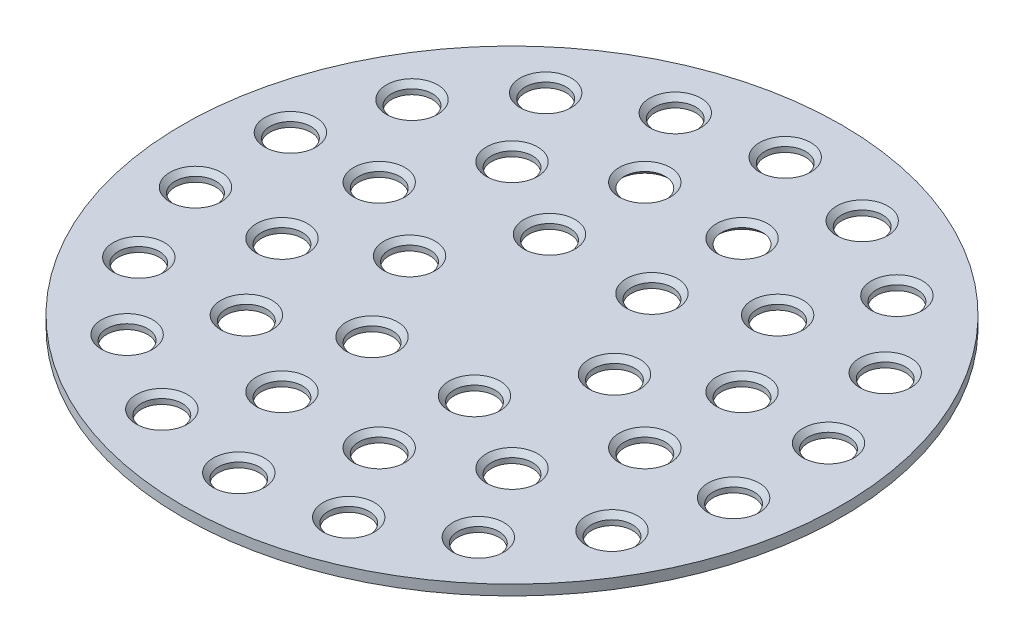
from build123d import *

# Parameters (mm, degrees)
SKETCH1_R           = 96.5
BOSS_EXTRUDE1_DEPTH = 3
SKETCH2_R           = 6
CUT_EXTRUDE3_DEPTH  = 10
CHAMFER3_SIZE       = 1.5


with BuildPart() as part:
    # Sketch1 → Boss-Extrude1 (new body)
    with BuildSketch(Plane(origin=(0, 0, 0), x_dir=(1, 0, 0), z_dir=(0, 1, 0))):
        with Locations(Location((0, 0, 0), (0, 0, 270))):
            Circle(SKETCH1_R)
    extrude(amount=BOSS_EXTRUDE1_DEPTH)

    # Sketch2 → Cut-Extrude3 (cut)
    with BuildSketch(Plane(origin=(0, 3, 0), x_dir=(1, 0, 0), z_dir=(0, 1, 0))):
        with Locations(Location((30, 0, 0), (0, 0, 270))):
            Circle(SKETCH2_R)
        with Locations(Location((53.125920446, 14.235047481, 0), (0, 0, 270))):
            Circle(SKETCH2_R)
        with Locations(Location((78.784620241, 13.891854213, 0), (0, 0, 270))):
            Circle(SKETCH2_R)
        with Locations(Location((15, -25.980762114, 0), (0, 0, 270))):
            Circle(SKETCH2_R)
        with Locations(Location((-15, -25.980762114, 0), (0, 0, 270))):
            Circle(SKETCH2_R)
        with Locations(Location((-30, 0, 0), (0, 0, 270))):
            Circle(SKETCH2_R)
        with Locations(Location((-15, 25.980762114, 0), (0, 0, 270))):
            Circle(SKETCH2_R)
        with Locations(Location((15, 25.980762114, 0), (0, 0, 270))):
            Circle(SKETCH2_R)
        with Locations(Location((53.125920446, -14.235047481, 0), (0, 0, 270))):
            Circle(SKETCH2_R)
        with Locations(Location((38.890872965, -38.890872965, 0), (0, 0, 270))):
            Circle(SKETCH2_R)
        with Locations(Location((14.235047481, -53.125920446, 0), (0, 0, 270))):
            Circle(SKETCH2_R)
        with Locations(Location((-14.235047481, -53.125920446, 0), (0, 0, 270))):
            Circle(SKETCH2_R)
        with Locations(Location((-38.890872965, -38.890872965, 0), (0, 0, 270))):
            Circle(SKETCH2_R)
        with Locations(Location((-53.125920446, -14.235047481, 0), (0, 0, 270))):
            Circle(SKETCH2_R)
        with Locations(Location((-53.125920446, 14.235047481, 0), (0, 0, 270))):
            Circle(SKETCH2_R)
        with Locations(Location((-38.890872965, 38.890872965, 0), (0, 0, 270))):
            Circle(SKETCH2_R)
        with Locations(Location((-14.235047481, 53.125920446, 0), (0, 0, 270))):
            Circle(SKETCH2_R)
        with Locations(Location((14.235047481, 53.125920446, 0), (0, 0, 270))):
            Circle(SKETCH2_R)
        with Locations(Location((38.890872965, 38.890872965, 0), (0, 0, 270))):
            Circle(SKETCH2_R)
        with Locations(Location((78.784620241, -13.891854213, 0), (0, 0, 270))):
            Circle(SKETCH2_R)
        with Locations(Location((69.282032303, -40, 0), (0, 0, 270))):
            Circle(SKETCH2_R)
        with Locations(Location((51.423008775, -61.28355545, 0), (0, 0, 270))):
            Circle(SKETCH2_R)
        with Locations(Location((27.361611466, -75.175409663, 0), (0, 0, 270))):
            Circle(SKETCH2_R)
        with Locations(Location((0, -80, 0), (0, 0, 270))):
            Circle(SKETCH2_R)
        with Locations(Location((-27.361611466, -75.175409663, 0), (0, 0, 270))):
            Circle(SKETCH2_R)
        with Locations(Location((-51.423008775, -61.28355545, 0), (0, 0, 270))):
            Circle(SKETCH2_R)
        with Locations(Location((-69.282032303, -40, 0), (0, 0, 270))):
            Circle(SKETCH2_R)
        with Locations(Location((-78.784620241, -13.891854213, 0), (0, 0, 270))):
            Circle(SKETCH2_R)
        with Locations(Location((-78.784620241, 13.891854213, 0), (0, 0, 270))):
            Circle(SKETCH2_R)
        with Locations(Location((-69.282032303, 40, 0), (0, 0, 270))):
            Circle(SKETCH2_R)
        with Locations(Location((-51.423008775, 61.28355545, 0), (0, 0, 270))):
            Circle(SKETCH2_R)
        with Locations(Location((-27.361611466, 75.175409663, 0), (0, 0, 270))):
            Circle(SKETCH2_R)
        with Locations(Location((0, 80, 0), (0, 0, 270))):
            Circle(SKETCH2_R)
        with Locations(Location((27.361611466, 75.175409663, 0), (0, 0, 270))):
            Circle(SKETCH2_R)
        with Locations(Location((51.423008775, 61.28355545, 0), (0, 0, 270))):
            Circle(SKETCH2_R)
        with Locations(Location((69.282032303, 40, 0), (0, 0, 270))):
            Circle(SKETCH2_R)
    extrude(amount=-CUT_EXTRUDE3_DEPTH, mode=Mode.SUBTRACT)

    # Chamfer3
    chamfer3_edges = [part.edges().sort_by_distance(p)[0] for p in [
        (-15, 3, -31.980762114),
        (-30, 3, -6),
        (-15, 3, 19.980762114),
        (15, 3, 19.980762114),
        (78.784620241, 3, -19.891854213),
        (53.125920446, 3, -20.235047481),
        (38.890872965, 3, 32.890872965),
        (14.235047481, 3, 47.125920446),
        (-14.235047481, 3, 47.125920446),
        (-38.890872965, 3, 32.890872965),
        (-53.125920446, 3, 8.235047481),
        (-53.125920446, 3, -20.235047481),
        (-38.890872965, 3, -44.890872965),
        (-14.235047481, 0, -59.125920446),
        (-14.235047481, 3, -59.125920446),
        (27.361611466, 3, -81.175409663),
        (51.423008775, 3, -67.28355545),
        (69.282032303, 3, -46),
        (30, 3, -6),
        (14.235047481, 0, -59.125920446),
        (14.235047481, 3, -59.125920446),
        (38.890872965, 3, -44.890872965),
        (78.784620241, 3, 7.891854213),
        (69.282032303, 3, 34),
        (51.423008775, 3, 55.28355545),
        (27.361611466, 3, 69.175409663),
        (0, 3, 74),
        (-27.361611466, 3, 69.175409663),
        (-51.423008775, 3, 55.28355545),
        (-69.282032303, 3, 34),
        (-78.784620241, 3, 7.891854213),
        (-78.784620241, 3, -19.891854213),
        (-69.282032303, 3, -46),
        (-51.423008775, 3, -67.28355545),
        (-27.361611466, 3, -81.175409663),
        (0, 3, -86),
        (53.125920446, 3, 8.235047481),
        (15, 3, -31.980762114),
    ]]
    chamfer(chamfer3_edges, length=CHAMFER3_SIZE - 0.0001)  # a hair under: the kernel refuses the full size


solid = part.part
